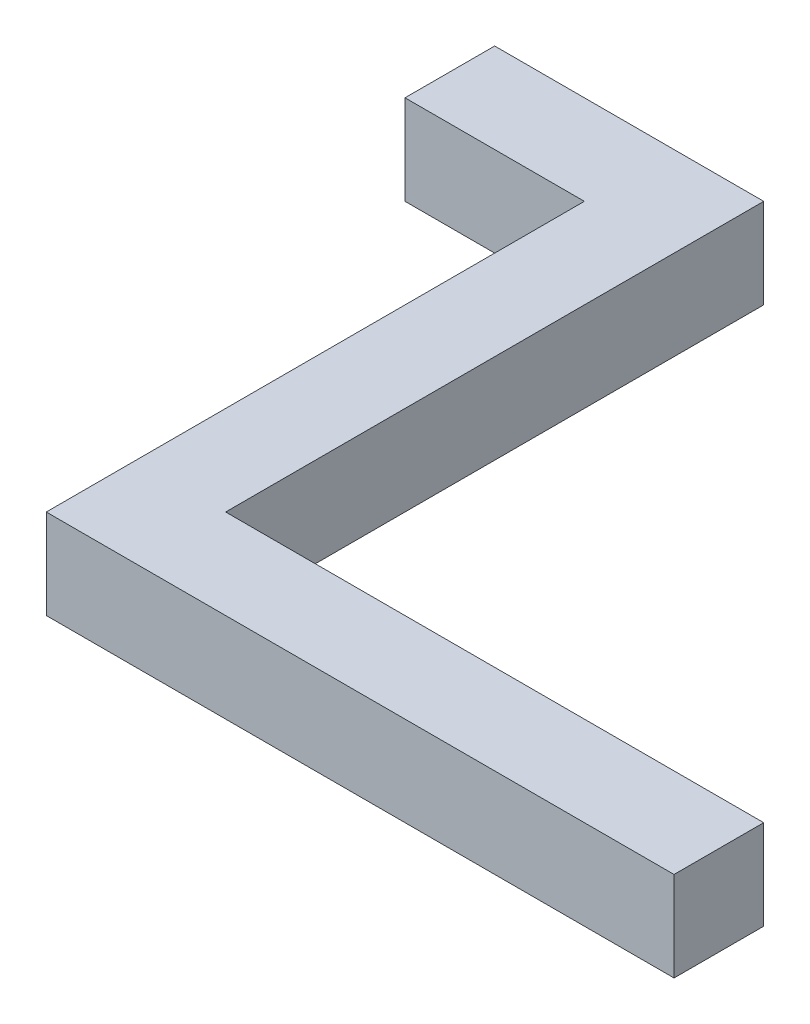
from build123d import *

# Parameters (mm, degrees)
BOSS_EXTRUDE1_DEPTH = 20


with BuildPart() as part:
    # Sketch1 → Boss-Extrude1 (new body)
    with BuildSketch(Plane(origin=(0, 0, 0), x_dir=(1, 0, 0), z_dir=(0, 1, 0))):
        Polygon((0, 0), (60, 0), (60, -68.077047995), (60, -120), (180, -120), (180, -140), (126.937455238, -140), (40, -140), (40, -20), (0, -20), align=None)
    extrude(amount=BOSS_EXTRUDE1_DEPTH)


solid = part.part
